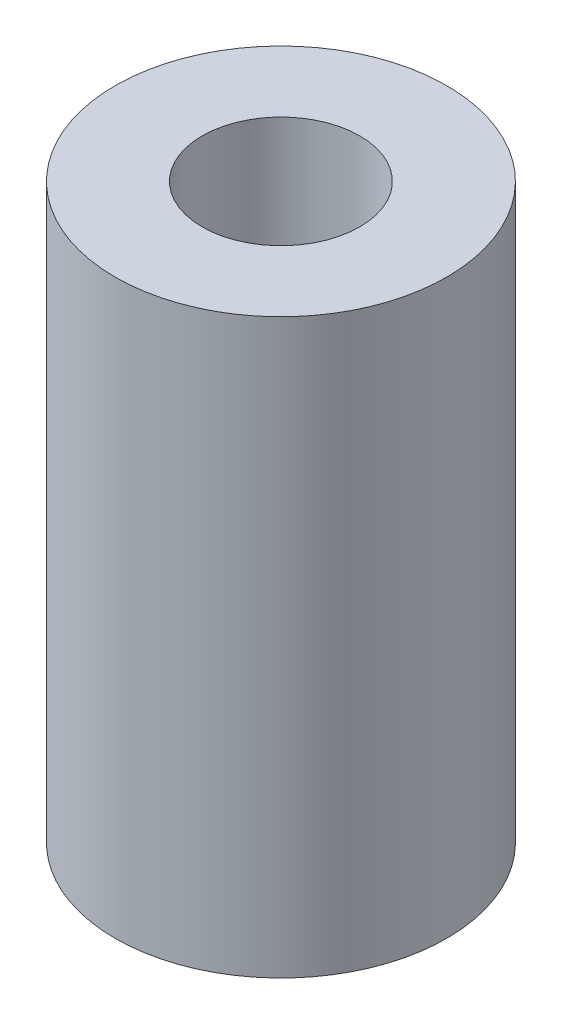
from build123d import *

# Parameters (mm, degrees)
SKETCH1_R           = 5
BOSS_EXTRUDE1_DEPTH = 17.270245409
SKETCH2_R           = 2.377460111
CUT_EXTRUDE1_DEPTH  = 19.661762416


with BuildPart() as part:
    # Sketch1 → Boss-Extrude1 (new body)
    with BuildSketch(Plane(origin=(0, 0, 0), x_dir=(1, 0, 0), z_dir=(0, 1, 0))):
        Circle(SKETCH1_R)
    extrude(amount=BOSS_EXTRUDE1_DEPTH)

    # Sketch2 → Cut-Extrude1 (cut, through all)
    with BuildSketch(Plane(origin=(0, 0, 0), x_dir=(1, 0, 0), z_dir=(0, 1, 0))):
        Circle(SKETCH2_R)
    extrude(amount=CUT_EXTRUDE1_DEPTH, mode=Mode.SUBTRACT)


solid = part.part
